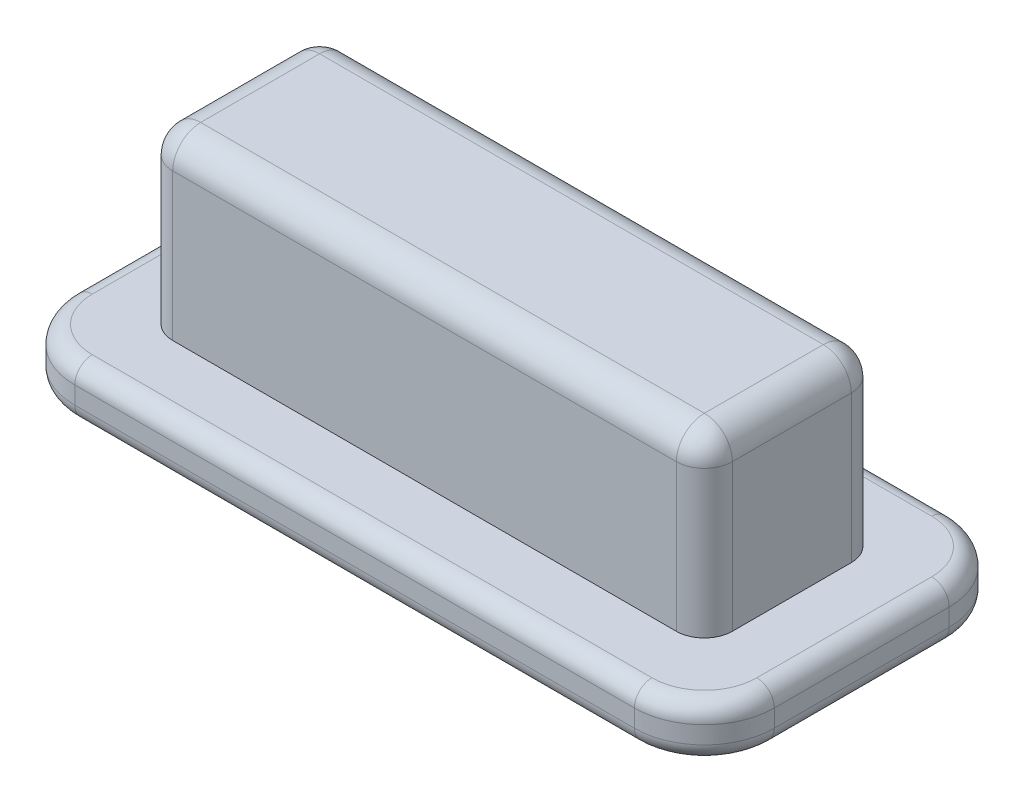
from build123d import *

# Parameters (mm, degrees)
SKETCH1_W           = 8
SKETCH1_H           = 2.5
BOSS_EXTRUDE1_DEPTH = 2.5
SKETCH2_W           = 10
SKETCH2_H           = 4.5
BOSS_EXTRUDE2_DEPTH = 0.75
FILLET1_R           = 0.4
FILLET2_R           = 0.4
FILLET3_R           = 1
FILLET4_R           = 0.25


with BuildPart() as part:
    # Sketch1 → Boss-Extrude1 (new body)
    with BuildSketch(Plane(origin=(0, 0, 0), x_dir=(1, 0, 0), z_dir=(0, 1, 0))):
        with Locations((4, 1.25)):
            Rectangle(SKETCH1_W, SKETCH1_H)
    extrude(amount=BOSS_EXTRUDE1_DEPTH)

    # Sketch2 → Boss-Extrude2 (add)
    with BuildSketch(Plane.XZ):
        with Locations((4, -1.25)):
            Rectangle(SKETCH2_W, SKETCH2_H)
    extrude(amount=BOSS_EXTRUDE2_DEPTH)

    # Fillet1
    fillet1_edges = [part.edges().sort_by_distance(p)[0] for p in [
        (8, 1.25, 0),
        (8, 1.25, -2.5),
        (0, 1.25, -2.5),
        (0, 1.25, 0),
    ]]
    fillet(fillet1_edges, radius=FILLET1_R)

    # Fillet2
    fillet2_edges = [part.edges().sort_by_distance(p)[0] for p in [
        (0.117157288, 2.5, -0.117157288),
        (0, 2.5, -1.25),
        (0.117157288, 2.5, -2.382842712),
        (4, 2.5, -2.5),
        (7.882842712, 2.5, -2.382842712),
        (8, 2.5, -1.25),
        (7.882842712, 2.5, -0.117157288),
        (4, 2.5, 0),
    ]]
    fillet(fillet2_edges, radius=FILLET2_R)

    # Fillet3
    fillet3_edges = [part.edges().sort_by_distance(p)[0] for p in [
        (9, -0.375, -3.5),
        (-1, -0.375, -3.5),
        (-1, -0.375, 1),
        (9, -0.375, 1),
    ]]
    fillet(fillet3_edges, radius=FILLET3_R)

    # Fillet4
    fillet4_edges = [part.edges().sort_by_distance(p)[0] for p in [
        (8.707106781, -0.75, 0.707106781),
        (9, -0.75, -1.25),
        (8.707106781, -0.75, -3.207106781),
        (4, -0.75, -3.5),
        (-0.707106781, -0.75, -3.207106781),
        (-1, -0.75, -1.25),
        (-0.707106781, -0.75, 0.707106781),
        (8.707106781, 0, 0.707106781),
        (9, 0, -1.25),
        (8.707106781, 0, -3.207106781),
        (4, 0, -3.5),
        (-0.707106781, 0, -3.207106781),
        (-1, 0, -1.25),
        (-0.7071067811865478, 0, 0.7071067811865477),
        (4, -0.75, 1),
        (4, 0, 1),
    ]]
    fillet(fillet4_edges, radius=FILLET4_R)


solid = part.part
